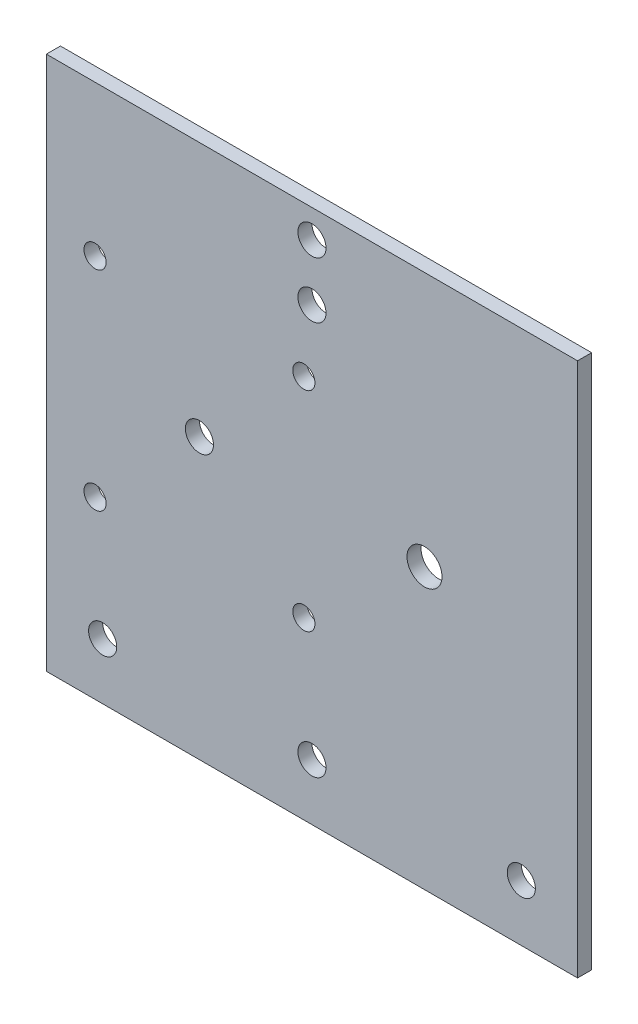
from build123d import *

# Parameters (mm, degrees)
SKETCH1_W           = 119.9
SKETCH1_H           = 120.65
SKETCH1_R           = 3.175
SKETCH1_R_2         = 2.5
SKETCH1_R_3         = 3.95
BOSS_EXTRUDE1_DEPTH = 3.175


with BuildPart() as part:
    # Sketch1 → Boss-Extrude1 (new body)
    with BuildSketch(Plane.XY):
        with Locations((59.95, 60.325)):
            Rectangle(SKETCH1_W, SKETCH1_H)
        with Locations((12.7, 12.7)):
            Circle(SKETCH1_R, mode=Mode.SUBTRACT)
        with Locations((59.95, 12.7)):
            Circle(SKETCH1_R, mode=Mode.SUBTRACT)
        with Locations((107.2, 12.7)):
            Circle(SKETCH1_R, mode=Mode.SUBTRACT)
        with Locations((34.55, 63.125)):
            Circle(SKETCH1_R, mode=Mode.SUBTRACT)
        with Locations((10.98, 86.695)):
            Circle(SKETCH1_R_2, mode=Mode.SUBTRACT)
        with Locations((58.12, 86.695)):
            Circle(SKETCH1_R_2, mode=Mode.SUBTRACT)
        with Locations((58.12, 39.555)):
            Circle(SKETCH1_R_2, mode=Mode.SUBTRACT)
        with Locations((10.98, 39.555)):
            Circle(SKETCH1_R_2, mode=Mode.SUBTRACT)
        with Locations((85.35, 63.125)):
            Circle(SKETCH1_R_3, mode=Mode.SUBTRACT)
        with Locations((59.95, 114.3)):
            Circle(SKETCH1_R, mode=Mode.SUBTRACT)
        with Locations((59.95, 101.6)):
            Circle(SKETCH1_R, mode=Mode.SUBTRACT)
    extrude(amount=BOSS_EXTRUDE1_DEPTH)


solid = part.part
